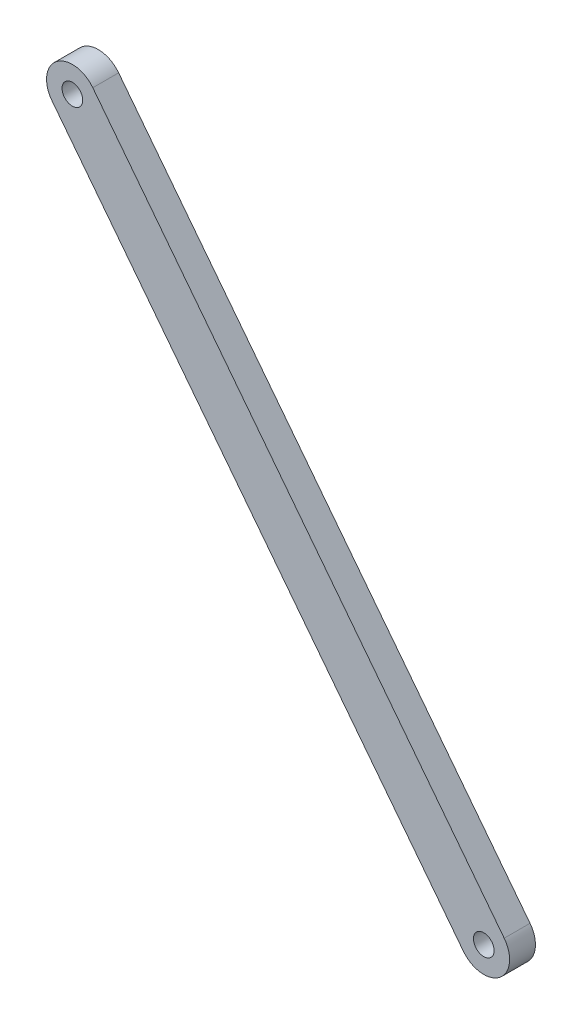
from build123d import *

# Parameters (mm, degrees)
BOSS_EXTRUDE1_START = 5
SKETCH1_R           = 2
BOSS_EXTRUDE1_DEPTH = 5


with BuildPart() as part:
    # Sketch1 → Boss-Extrude1 (new body)
    with BuildSketch(Plane.XY.offset(BOSS_EXTRUDE1_START)):
        with BuildLine():
            Line((-97.659874865, 152.356003876), (-18.022935223, 49.604080077))
            ThreePointArc((-18.022935223, 49.604080077), (-18.911973075, 42.589123791), (-25.926929361, 43.478161643))
            Line((-25.926929361, 43.478161643), (-105.563869003, 146.230085442))
            ThreePointArc((-105.563869003, 146.230085442), (-104.674831151, 153.245041728), (-97.659874865, 152.356003876))
        make_face()
        with Locations((-101.611871934, 149.293044659)):
            Circle(SKETCH1_R, mode=Mode.SUBTRACT)
        with Locations((-21.974932292, 46.54112086)):
            Circle(SKETCH1_R, mode=Mode.SUBTRACT)
    extrude(amount=BOSS_EXTRUDE1_DEPTH)


solid = part.part
